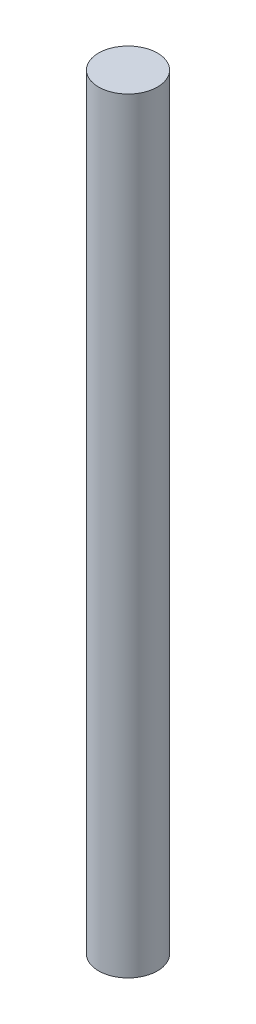
from build123d import *

# Parameters (mm, degrees)
SKETCH1_R           = 1
BOSS_EXTRUDE1_DEPTH = 26


with BuildPart() as part:
    # Sketch1 → Boss-Extrude1 (new body)
    with BuildSketch(Plane(origin=(0, 0, 0), x_dir=(1, 0, 0), z_dir=(0, 1, 0))):
        Circle(SKETCH1_R)
    extrude(amount=BOSS_EXTRUDE1_DEPTH)


solid = part.part
